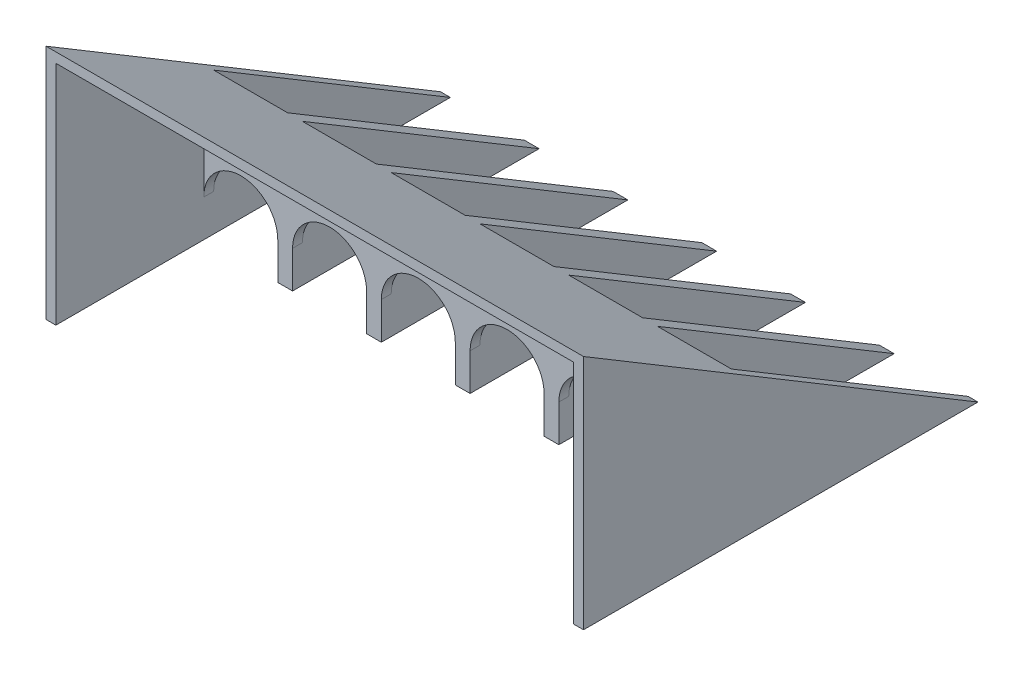
from build123d import *

# Parameters (mm, degrees)
SALIENTE_EXTRUIR1_DEPTH = 218
CROQUIS4_W              = 30.00000000000003
CROQUIS4_H              = 96.00000000000001
CROQUIS4_W_2            = 30
CORTAR_EXTRUIR1_DEPTH   = 60
CORTAR_EXTRUIR2_DEPTH   = 10
REDONDEO1_R             = 15


with BuildPart() as part:
    # Croquis2 → Saliente-Extruir1 (new body)
    with BuildSketch(Plane(origin=(0, 0, 0), x_dir=(0, 0, -1), z_dir=(1, 0, 0))):
        Polygon((-60.000000000000014, 35.99999999999998), (-59.99999999999997, -60), (100, -59.99999999999999), align=None)
    extrude(amount=SALIENTE_EXTRUIR1_DEPTH)

    # Croquis3 → Cortar-Recubrir1 section 0
    with BuildSketch(Plane.XY.offset(60)):
        with BuildLine():
            Line((4, 32), (214, 32))
            Line((214, 32), (214, -59.99999999999997))
            Line((214, -59.99999999999997), (4.0000000000000115, -59.99999999999997))
            Line((4.0000000000000115, -59.99999999999997), (4, 32))
        make_face()
    # Croquis3D3 → Cortar-Recubrir1 section 1
    with BuildSketch(Plane(origin=(4, -3.9999999999999964, 0), x_dir=(0.9662349396012463, -0.25766265056033233, 0), z_dir=(0, 0, 1))):
        with BuildLine():
            Line((0, 0), (202.9093373162617, 54.10915661766981))
            Line((202.9093373162617, 54.10915661766981), (217.33844574764032, 0))
            Line((217.33844574764032, 0), (14.42910843137861, -54.1091566176698))
            Line((14.42910843137861, -54.1091566176698), (0, 0))
        make_face()
    loft(mode=Mode.SUBTRACT)

    # Croquis4 → Cortar-Extruir1 (cut)
    with BuildSketch(Plane.XZ.offset(60)):
        Polygon((3.9999999999999982, -4), (33.99999999999999, -4), (34, -100), (4.000000000000011, -100), align=None)
        Polygon((40, -4), (70, -4), (70, -100), (40.000000000000014, -100), align=None)
        Polygon((76.00000000000001, -3.9999999999999973), (106.00000000000001, -3.9999999999999973), (106.00000000000003, -100), (76.00000000000003, -100), align=None)
        Polygon((112.00000000000001, -4), (142.00000000000003, -4), (142.00000000000003, -100), (112.00000000000003, -100), align=None)
        with Locations((199, -52.00000000000001)):
            Rectangle(CROQUIS4_W, CROQUIS4_H)
        with Locations((163.00000000000003, -52.00000000000001)):
            Rectangle(CROQUIS4_W_2, CROQUIS4_H)
    extrude(amount=-CORTAR_EXTRUIR1_DEPTH, mode=Mode.SUBTRACT)

    # Croquis5 → Cortar-Extruir2 (cut)
    with BuildSketch(Plane(origin=(0, 1.7e-16, -3.9999999999999973), x_dir=(-1, 0, 0), z_dir=(0, 4e-17, -1))):
        Polygon((-199, -60), (-184, -60), (-184, -29.999999999999993), (-214.00000000000006, -30), (-214.00000000000003, -60), align=None)
        Polygon((-163.00000000000003, -60), (-148.00000000000003, -60), (-148.00000000000006, -30.000000000000004), (-178.00000000000006, -30.00000000000001), (-178.00000000000006, -60), align=None)
        Polygon((-127, -60), (-112, -60), (-112, -30), (-142.00000000000003, -30.000000000000004), (-142.00000000000003, -60), align=None)
        Polygon((-91.00000000000001, -60), (-76.00000000000001, -59.99999999999999), (-76.00000000000001, -29.999999999999993), (-106.00000000000003, -29.999999999999993), (-106.00000000000001, -60), align=None)
        Polygon((-55.00000000000001, -60), (-40.00000000000001, -60), (-40.00000000000001, -30), (-70.00000000000001, -30.000000000000007), (-70, -60), align=None)
        Polygon((-18.999999999999996, -60), (-3.9999999999999964, -60), (-3.9999999999999964, -30), (-33.99999999999999, -30), (-33.99999999999999, -60), align=None)
    extrude(amount=-CORTAR_EXTRUIR2_DEPTH, mode=Mode.SUBTRACT)

    # Redondeo1
    redondeo1_edges = [part.edges().sort_by_distance(p)[0] for p in [
        (3.9999999999999964, -30, -1.9999999999999993),
        (33.99999999999999, -30, -1.9999999999999991),
        (40.00000000000001, -30, -1.9999999999999993),
        (70.00000000000001, -30.000000000000007, -1.9999999999999993),
        (76.00000000000001, -29.999999999999993, -1.9999999999999991),
        (106.00000000000003, -29.999999999999993, -1.9999999999999993),
        (112, -30, -1.9999999999999993),
        (142.00000000000003, -30.000000000000004, -1.9999999999999993),
        (148.00000000000006, -30.000000000000004, -1.9999999999999993),
        (178.00000000000006, -30.00000000000001, -1.9999999999999993),
        (184, -29.999999999999993, -1.9999999999999993),
        (214.00000000000006, -30, -1.9999999999999993),
    ]]
    fillet(redondeo1_edges, radius=REDONDEO1_R - 0.0001)  # a hair under: the kernel refuses the full size


solid = part.part
